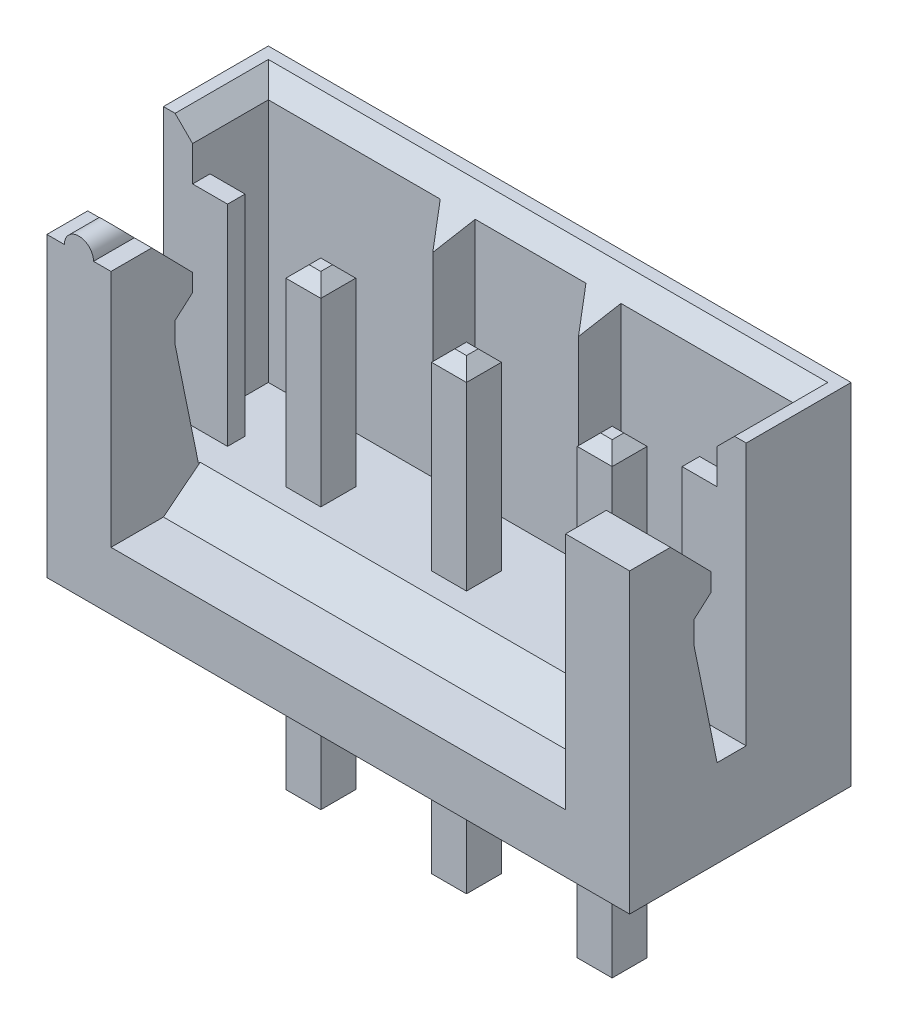
from build123d import *

# Parameters (mm, degrees)
SKETCH_1_W                         = 10
SKETCH_1_H                         = 3.8
EXTRUDE_1_DEPTH                    = 6
CUT_EXTRUDE_1_DEPTH                = 5
CUT_EXTRUDE_2_DEPTH                = 13.265398485
EXTRUDE_2_REACH                    = 14.265
CUT_EXTRUDE_3_REACH                = 14.265
SKETCH_5_W                         = 7.8
SKETCH_5_H                         = 4.1
EXTRUDE_3_REACH                    = 13.861
EXTRUDE_5_REACH                    = 14.265
SKETCH_11_W                        = 2
SKETCH_11_H                        = 3.2
SKETCH_11_W_2                      = 0.8
SKETCH_11_H_2                      = 0.8
CUT_EXTRUDE_5_DEPTH                = 0.3
SKETCH_15_R                        = 0.05
CUT_EXTRUDE_6_DEPTH                = 0.1
CHAMFER_7_SIZE                     = 0.3
PATTERN_LINEAR_2_COUNT             = 2
PATTERN_LINEAR_2_PITCH             = 2.5
EXTRUDE_START                      = -4.8
SKETCH_7_W                         = 0.6
SKETCH_7_H                         = 0.6
EXTRUDE_4_DEPTH                    = 8
CHAMFER_6_SIZE                     = 0.2
PATTERN_LINEAR_1_COUNT             = 3
PATTERN_LINEAR_1_PITCH             = 2.5
CHAMFER_7_OF_PATTERN_LINEAR_1_SIZE = 0.3
CHAMFER_6_OF_PATTERN_LINEAR_1_SIZE = 0.2
CUT_EXTRUDE_4_REACH                = 13.861
CHAMFER_5_SIZE                     = 0.3


with BuildPart() as part:
    # Эскиз1 → Бобышка-Вытянуть1 (new body)
    with BuildSketch(Plane(origin=(0, 0, 0), x_dir=(1, 0, 0), z_dir=(0, 1, 0))):
        with Locations((5, -1.9)):
            Rectangle(SKETCH_1_W, SKETCH_1_H)
    extrude(amount=EXTRUDE_1_DEPTH)

    # Эскиз2 → Вырез-Вытянуть1 (cut)
    with BuildSketch(Plane(origin=(0, 6, 0), x_dir=(1, 0, 0), z_dir=(0, 1, 0))):
        Polygon((0.5, -0.5), (9.5, -0.5), (9.5, -1.5), (8.9, -1.5), (8.9, -3.3), (1.1, -3.3), (1.1, -1.5), (0.5, -1.5), align=None)
    extrude(amount=-CUT_EXTRUDE_1_DEPTH, mode=Mode.SUBTRACT)

    # Эскиз3 → Вырез-Вытянуть2 (cut, through all)
    with BuildSketch(Plane.ZY):
        Polygon((1.8, 6), (1.8, 1.5), (2.3, 1.5), (2.7, 3.459591794), (2.7, 3.821282026), (2.4, 4.085857157), (2.4, 4.385857157), (3.1, 5.1), (3.8, 5.1), (3.8, 6), align=None)
    extrude(amount=-CUT_EXTRUDE_2_DEPTH, mode=Mode.SUBTRACT)

    # Бобышка-Вытянуть2: up to this plane
    extrude_2_end = Plane(origin=(10, 5.1, 3.1), z_dir=(0, -0.6999999999999996, 0.7141428428542854))
    # Эскиз4 → Бобышка-Вытянуть2 (add, up to the surface)
    with BuildSketch(Plane.XY.offset(3.8), mode=Mode.PRIVATE) as extrude_2_sk1:
        with BuildLine():
            Line((0.3, 5.1), (0.8, 5.1))
            ThreePointArc((0.8, 5.1), (0.55, 5.35), (0.3, 5.1))
        make_face()
    extrude_2_tool1 = split(extrude(extrude_2_sk1.sketch, amount=-EXTRUDE_2_REACH, mode=Mode.PRIVATE), bisect_by=extrude_2_end, keep=Keep.BOTH, mode=Mode.PRIVATE)
    add(extrude_2_tool1.solids().sort_by_distance((0.55, 5.206103, 3.8))[0])

    # Эскиз5 → Вырез-Вытянуть3 (cut, up to next)
    with BuildSketch(Plane.XY.offset(3.8), mode=Mode.PRIVATE) as cut_extrude_3_sk1:
        with Locations((5, 3.05)):
            Rectangle(SKETCH_5_W, SKETCH_5_H)
    cut_extrude_3_tool1 = extrude(cut_extrude_3_sk1.sketch, amount=-CUT_EXTRUDE_3_REACH, mode=Mode.PRIVATE) & part.part
    add(cut_extrude_3_tool1.solids().sort_by_distance((5, 3.05, 3.8))[0], mode=Mode.SUBTRACT)

    # Эскиз6 → Бобышка-Вытянуть3 (add, up to next)
    with BuildSketch(Plane(origin=(0.5, 0, 0), x_dir=(0, 0, -1), z_dir=(1, 0, 0)), mode=Mode.PRIVATE) as extrude_3_sk1:
        Polygon((-2.9, 1), (-2.27, 1.5), (-0.5, 1.5), (-0.5, 1), align=None)
    extrude_3_tool1 = extrude(extrude_3_sk1.sketch, amount=EXTRUDE_3_REACH, mode=Mode.PRIVATE) - part.part
    add(extrude_3_tool1.solids().sort_by_distance((0.5, 1.23741, 1.550432))[0])

    # Эскиз9 → Бобышка-Вытянуть5 (add, up to next)
    with BuildSketch(Plane(origin=(0, 6, 0), x_dir=(1, 0, 0), z_dir=(0, 1, 0)), mode=Mode.PRIVATE) as extrude_5_sk1:
        Polygon((3.45, -0.5), (3.75, -0.928444402), (4.05, -0.5), align=None)
    extrude_5_tool1 = extrude(extrude_5_sk1.sketch, amount=-EXTRUDE_5_REACH, mode=Mode.PRIVATE) - part.part
    extrude_5 = extrude_5_tool1.solids().sort_by_distance((3.75, 6, 0.642815))[0]
    add(extrude_5)

    # Эскиз11 → Вырез-Вытянуть5 (cut)
    with BuildSketch(Plane.XZ):
        with Locations((2.5, 1.6)):
            Rectangle(SKETCH_11_W, SKETCH_11_H)
        with Locations((2.5, 1.6)):
            Rectangle(SKETCH_11_W_2, SKETCH_11_H_2, mode=Mode.SUBTRACT)
    cut_extrude_5 = extrude(amount=-CUT_EXTRUDE_5_DEPTH, mode=Mode.SUBTRACT)

    # Эскиз15 → Вырез-Вытянуть6 (cut)
    with BuildSketch(Plane.XZ):
        with Locations(Location((2.5, 1.6, 0), (0, 0, 270))):
            Circle(SKETCH_15_R)
    extrude(amount=-CUT_EXTRUDE_6_DEPTH, mode=Mode.SUBTRACT)

    # Фаска7
    chamfer_7_edges = [part.edges().sort_by_distance(p)[0] for p in [
        (1.5, 0.3, 1.6),
        (2.5, 0.3, 3.2),
        (3.5, 0.3, 1.6),
        (2.9, 0.3, 1.6),
        (2.5, 0.3, 2),
        (2.1, 0.3, 1.6),
        (2.5, 0.3, 1.2),
    ]]
    chamfer(chamfer_7_edges, length=CHAMFER_7_SIZE - 0.0001)  # a hair under: the kernel refuses the full size

    # Линейный массив2: Бобышка-Вытянуть5 ×2
    with Locations(*[(i * PATTERN_LINEAR_2_PITCH, 0, 0) for i in range(1, PATTERN_LINEAR_2_COUNT)]):
        add(extrude_5)

    # Эскиз7 → Бобышка-Вытянуть4 (add)
    with BuildSketch(Plane.XZ.offset(EXTRUDE_START)):
        with Locations((2.5, 1.6)):
            Rectangle(SKETCH_7_W, SKETCH_7_H)
    extrude_4 = extrude(amount=EXTRUDE_4_DEPTH)

    # Фаска6
    chamfer_6_edges = [part.edges().sort_by_distance(p)[0] for p in [
        (2.8, 4.8, 1.6),
        (2.5, 4.8, 1.9),
        (2.2, 4.8, 1.6),
        (2.5, 4.8, 1.3),
        (2.8, -3.2, 1.6),
        (2.5, -3.2, 1.9),
        (2.2, -3.2, 1.6),
        (2.5, -3.2, 1.3),
    ]]
    chamfer(chamfer_6_edges, length=CHAMFER_6_SIZE)

    # Линейный массив1: Вырез-Вытянуть5, Бобышка-Вытянуть4 ×3
    with Locations(*[(i * PATTERN_LINEAR_1_PITCH, 0, 0) for i in range(1, PATTERN_LINEAR_1_COUNT)]):
        add(cut_extrude_5, mode=Mode.SUBTRACT)
        add(extrude_4)

    # Фаска7 of Линейный массив1
    chamfer_7_of_pattern_linear_1_edges = [part.edges().sort_by_distance(p)[0] for p in [
        (4, 0.3, 1.6),
        (5, 0.3, 3.2),
        (6, 0.3, 1.6),
        (5.4, 0.3, 1.6),
        (5, 0.3, 2),
        (4.6, 0.3, 1.6),
        (5, 0.3, 1.2),
        (6.5, 0.3, 1.6),
        (7.5, 0.3, 3.2),
        (8.5, 0.3, 1.6),
        (7.9, 0.3, 1.6),
        (7.5, 0.3, 2),
        (7.1, 0.3, 1.6),
        (7.5, 0.3, 1.2),
    ]]
    chamfer(chamfer_7_of_pattern_linear_1_edges, length=CHAMFER_7_OF_PATTERN_LINEAR_1_SIZE - 0.0001)  # a hair under: the kernel refuses the full size

    # Фаска6 of Линейный массив1
    chamfer_6_of_pattern_linear_1_edges = [part.edges().sort_by_distance(p)[0] for p in [
        (5.3, 4.8, 1.6),
        (5, 4.8, 1.9),
        (4.7, 4.8, 1.6),
        (5, 4.8, 1.3),
        (5.3, -3.2, 1.6),
        (5, -3.2, 1.9),
        (4.7, -3.2, 1.6),
        (5, -3.2, 1.3),
        (7.8, 4.8, 1.6),
        (7.5, 4.8, 1.9),
        (7.2, 4.8, 1.6),
        (7.5, 4.8, 1.3),
        (7.8, -3.2, 1.6),
        (7.5, -3.2, 1.9),
        (7.2, -3.2, 1.6),
        (7.5, -3.2, 1.3),
    ]]
    chamfer(chamfer_6_of_pattern_linear_1_edges, length=CHAMFER_6_OF_PATTERN_LINEAR_1_SIZE)

    # Вырез-Вытянуть4: up to this face of the body (flat: up to its plane)
    cut_extrude_4_end = Plane(part.part.faces().sort_by_distance((9.5, 3.75, 1))[0])
    # Эскиз10 → Вырез-Вытянуть4 (cut, up to the picked face)
    with BuildSketch(Plane(origin=(0.5, 0, 0), x_dir=(0, 0, -1), z_dir=(1, 0, 0)), mode=Mode.PRIVATE) as cut_extrude_4_sk1:
        Polygon((-1, 6), (-0.2, 6), (-1, 5.2), (-1, 5.1), (-1.8, 5.1), (-1.8, 6), align=None)
    cut_extrude_4_tool1 = split(extrude(cut_extrude_4_sk1.sketch, amount=CUT_EXTRUDE_4_REACH, mode=Mode.PRIVATE), bisect_by=cut_extrude_4_end, keep=Keep.BOTH, mode=Mode.PRIVATE)
    add(cut_extrude_4_tool1.solids().sort_by(Axis((0.5, 5.60641, 1.194872), (1, 0, 0)))[0], mode=Mode.SUBTRACT)

    # Фаска5
    chamfer_5_edges = [part.edges().sort_by_distance(p)[0] for p in [
        (9.5, 6, 1),
        (0.5, 6, 1),
    ]]
    chamfer(chamfer_5_edges, length=CHAMFER_5_SIZE)


solid = part.part
